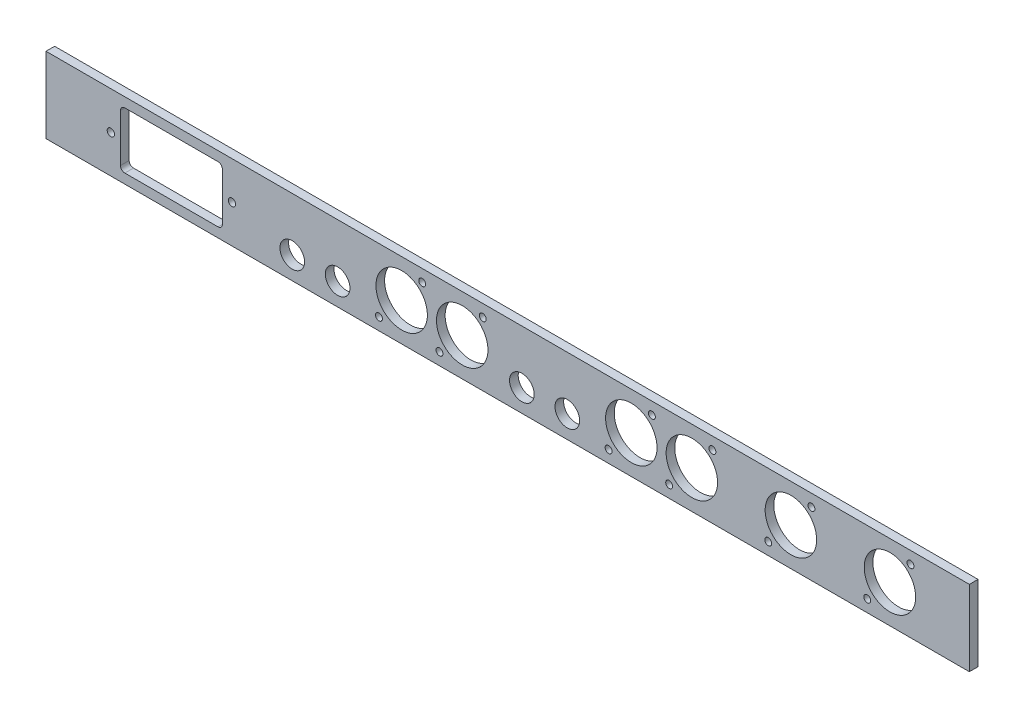
from build123d import *

# Parameters (mm, degrees)
SKETCH1_W           = 427
SKETCH1_H           = 35
BOSS_EXTRUDE1_DEPTH = 4
SKETCH2_R           = 11.9
SKETCH2_R_2         = 1.6
SKETCH2_R_3         = 5.7
SKETCH2_R_4         = 1.7
CUT_EXTRUDE1_DEPTH  = 4


with BuildPart() as part:
    # Sketch1 → Boss-Extrude1 (new body)
    with BuildSketch(Plane.XY):
        Rectangle(SKETCH1_W, SKETCH1_H)
    extrude(amount=BOSS_EXTRUDE1_DEPTH)

    # Sketch2 → Cut-Extrude1 (cut)
    with BuildSketch(Plane.XY.offset(4)):
        with Locations((-21.0231835, 0)):
            Circle(SKETCH2_R)
        with Locations((-31.516348962, -11.9)):
            Circle(SKETCH2_R_2)
        with Locations((-11.516348962, 11.9)):
            Circle(SKETCH2_R_2)
        with Locations((-59.516348962, -11.9)):
            Circle(SKETCH2_R_2)
        with Locations((-49.0231835, 0)):
            Circle(SKETCH2_R)
        with Locations((-39.516348962, 11.9)):
            Circle(SKETCH2_R_2)
        with Locations((120.481325778, -11.9)):
            Circle(SKETCH2_R_2)
        with Locations((140.481325778, 11.9)):
            Circle(SKETCH2_R_2)
        with Locations((130.97449124, 0)):
            Circle(SKETCH2_R)
        with Locations((166.281325778, -11.9)):
            Circle(SKETCH2_R_2)
        with Locations((186.281325778, 11.9)):
            Circle(SKETCH2_R_2)
        with Locations((176.77449124, 0)):
            Circle(SKETCH2_R)
        with Locations((-78.6231835, -7.125)):
            Circle(SKETCH2_R_3)
        with Locations((-99.6231835, -7.125)):
            Circle(SKETCH2_R_3)
        with Locations((27.57449124, -7.125)):
            Circle(SKETCH2_R_3)
        with Locations((74.681325778, -11.9)):
            Circle(SKETCH2_R_2)
        with Locations((94.681325778, 11.9)):
            Circle(SKETCH2_R_2)
        with Locations((57.17449124, 0)):
            Circle(SKETCH2_R)
        with Locations((85.17449124, 0)):
            Circle(SKETCH2_R)
        with Locations((6.57449124, -7.125)):
            Circle(SKETCH2_R_3)
        with Locations((66.681325778, 11.9)):
            Circle(SKETCH2_R_2)
        with Locations((46.681325778, -11.9)):
            Circle(SKETCH2_R_2)
        with Locations((-127.5, 0)):
            Circle(SKETCH2_R_4)
        with Locations((-183.5, 0)):
            Circle(SKETCH2_R_4)
        with BuildLine():
            Line((-177.05, -13.05), (-133.95, -13.05))
            ThreePointArc((-133.95, -13.05), (-132.535786438, -12.464213562), (-131.95, -11.05))
            Line((-131.95, -11.05), (-131.95, 11.05))
            ThreePointArc((-131.95, 11.05), (-132.535786438, 12.464213562), (-133.95, 13.05))
            Line((-133.95, 13.05), (-177.05, 13.05))
            ThreePointArc((-177.05, 13.05), (-178.464213562, 12.464213562), (-179.05, 11.05))
            Line((-179.05, 11.05), (-179.05, -11.05))
            ThreePointArc((-179.05, -11.05), (-178.464213562, -12.464213562), (-177.05, -13.05))
        make_face()
    extrude(amount=-CUT_EXTRUDE1_DEPTH, mode=Mode.SUBTRACT)


solid = part.part
